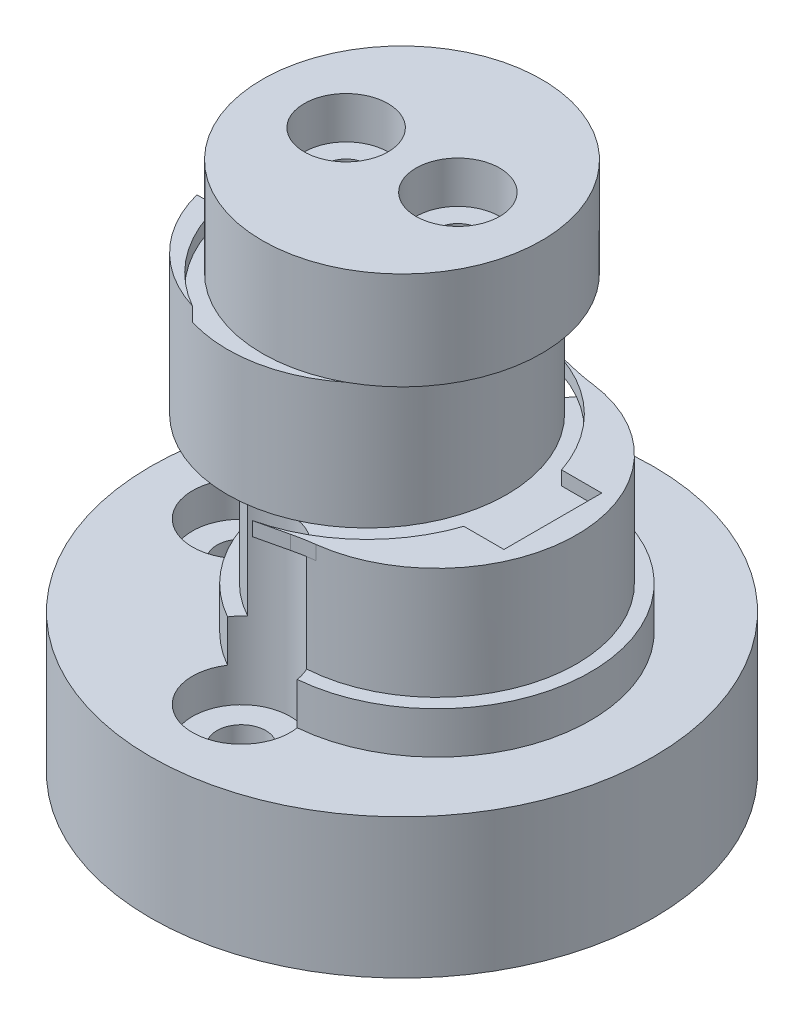
from build123d import *

# Parameters (mm, degrees)
SKETCH2_R           = 18
BOSS_EXTRUDE1_DEPTH = 10
SKETCH3_R           = 10
BOSS_EXTRUDE2_DEPTH = 10
SKETCH4_R           = 10
BOSS_EXTRUDE3_DEPTH = 10
SKETCH5_R           = 10
BOSS_EXTRUDE4_DEPTH = 8
SKETCH7_R           = 11
SKETCH7_R_2         = 10
BOSS_EXTRUDE5_DEPTH = 3
SKETCH8_R           = 11.000000000518183
SKETCH8_R_2         = 10.000000000518181
BOSS_EXTRUDE6_DEPTH = 1
SKETCH9_R           = 11
SKETCH9_R_2         = 2
BOSS_EXTRUDE7_DEPTH = 1
SKETCH11_R          = 1.4999999999999996
CUT_EXTRUDE4_DEPTH  = 35
SKETCH12_R          = 14.499999999998145
CUT_EXTRUDE5_DEPTH  = 5.5
SKETCH14_R          = 1.75
SKETCH14_R_2        = 1.7499999999999993
SKETCH14_R_3        = 1.7499999999999996
CUT_EXTRUDE6_DEPTH  = 4.5
CUT_EXTRUDE7_REACH  = 39.842
SKETCH15_R          = 3.5
SKETCH15_R_2        = 3.4999999999999996
CUT_EXTRUDE8_START  = -2.5
SKETCH15_2_R        = 3.5
SKETCH15_2_R_2      = 3.4999999999999996
CUT_EXTRUDE8_DEPTH  = 2.5
BOSS_EXTRUDE8_DEPTH = 1
CUT_EXTRUDE11_DEPTH = 4
SKETCH19_R          = 3
CUT_EXTRUDE12_DEPTH = 3
FILLET1_R           = 15
BOSS_EXTRUDE9_DEPTH = 1
CUT_EXTRUDE14_START = -1
SKETCH21_R          = 10.000000000518181
CUT_EXTRUDE14_DEPTH = 1
CUT_EXTRUDE18_DEPTH = 1


with BuildPart() as part:
    # Sketch2 → Boss-Extrude1 (new body)
    with BuildSketch(Plane.XZ):
        with Locations(Location((0, 0, 0), (0, 0, 270))):
            Circle(SKETCH2_R)
    extrude(amount=-BOSS_EXTRUDE1_DEPTH)

    # Sketch3 → Boss-Extrude2 (add)
    with BuildSketch(Plane(origin=(0, 10, 0), x_dir=(1, 0, 0), z_dir=(0, 1, 0))):
        with Locations(Location((2.5, 0, 0), (0, 0, 270))):
            Circle(SKETCH3_R)
    extrude(amount=BOSS_EXTRUDE2_DEPTH)

    # Sketch4 → Boss-Extrude3 (add)
    with BuildSketch(Plane(origin=(0, 20, 0), x_dir=(1, 0, 0), z_dir=(0, 1, 0))):
        with Locations(Location((-2.5000000000000004, 0, 0), (0, 0, 75.522487814))):
            Circle(SKETCH4_R)
    extrude(amount=BOSS_EXTRUDE3_DEPTH)

    # Sketch5 → Boss-Extrude4 (add)
    with BuildSketch(Plane(origin=(0, 30, 0), x_dir=(1, 0, 0), z_dir=(0, 1, 0))):
        with Locations(Location((0, 0, 0), (0, 0, 97.180755781))):
            Circle(SKETCH5_R)
    extrude(amount=BOSS_EXTRUDE4_DEPTH)

    # Sketch7 → Boss-Extrude5 (add)
    with BuildSketch(Plane(origin=(0, 10, 0), x_dir=(1, 0, 0), z_dir=(0, 1, 0))):
        with Locations(Location((2.5, 0, 0), (0, 0, 90))):
            Circle(SKETCH7_R)
        with Locations(Location((2.5, 0, 0), (0, 0, 104.477512186))):
            Circle(SKETCH7_R_2, mode=Mode.SUBTRACT)
    extrude(amount=BOSS_EXTRUDE5_DEPTH)

    # Sketch8 → Boss-Extrude6 (add)
    with BuildSketch(Plane(origin=(0, 20, 0), x_dir=(1, 0, 0), z_dir=(0, 1, 0))):
        with Locations(Location((-2.5000000000000004, 0, 0), (0, 0, 65.280148812))):
            Circle(SKETCH8_R)
        with Locations(Location((-2.5000000000000004, 0, 0), (0, 0, 82.819244219))):
            Circle(SKETCH8_R_2, mode=Mode.SUBTRACT)
    extrude(amount=BOSS_EXTRUDE6_DEPTH)

    # Sketch9 → Boss-Extrude7 (add)
    with BuildSketch(Plane(origin=(0, 30, 0), x_dir=(1, 0, 0), z_dir=(0, 1, 0))):
        with Locations(Location((0, 0, 0), (0, 0, 119.699728045))):
            Circle(SKETCH9_R)
        Circle(SKETCH9_R_2, mode=Mode.SUBTRACT)
    extrude(amount=BOSS_EXTRUDE7_DEPTH)

    # Sketch11 → Cut-Extrude4 (cut)
    with BuildSketch(Plane(origin=(0, 38, 0), x_dir=(1, 0, 0), z_dir=(0, 1, 0))):
        with Locations(Location((4, 0, 0), (0, 0, 270))):
            Circle(SKETCH11_R)
        with Locations(Location((-4, 0, 0), (0, 0, 90))):
            Circle(SKETCH11_R)
    extrude(amount=-CUT_EXTRUDE4_DEPTH, mode=Mode.SUBTRACT)

    # Sketch12 → Cut-Extrude5 (cut)
    with BuildSketch(Plane(origin=(0, 0, 0), x_dir=(-1, 0, 0), z_dir=(0, -1, 0))):
        with Locations(Location((0, 0, 0), (0, 0, 90))):
            Circle(SKETCH12_R)
    extrude(amount=-CUT_EXTRUDE5_DEPTH, mode=Mode.SUBTRACT)

    # Sketch14 → Cut-Extrude6 (cut)
    with BuildSketch(Plane(origin=(0, 10, 0), x_dir=(1, 0, 0), z_dir=(0, 1, 0))):
        with Locations(Location((-11.5, 2.65611e-12, 0), (0, 0, 270))):
            Circle(SKETCH14_R)
        with Locations(Location((0, -11.5, 0), (0, 0, 270))):
            Circle(SKETCH14_R_2)
        with Locations(Location((-4.23e-15, 11.5, 0), (0, 0, 270))):
            Circle(SKETCH14_R_3)
    extrude(amount=-CUT_EXTRUDE6_DEPTH, mode=Mode.SUBTRACT)

    # Cut-Extrude7: up to this face of the body (flat: up to its plane)
    cut_extrude7_end = Plane(part.part.faces().sort_by_distance((8.77903562, 20, 0))[0])
    # Sketch15 → Cut-Extrude7 (cut, up to the picked face)
    with BuildSketch(Plane(origin=(0, 10, 0), x_dir=(1, 0, 0), z_dir=(0, 1, 0)), mode=Mode.PRIVATE) as cut_extrude7_sk1:
        with Locations((-11.5, 2.65611e-12)):
            Circle(SKETCH15_R)
    cut_extrude7_tool1 = split(extrude(cut_extrude7_sk1.sketch, amount=CUT_EXTRUDE7_REACH, mode=Mode.PRIVATE), bisect_by=cut_extrude7_end, keep=Keep.BOTH, mode=Mode.PRIVATE)
    # Sketch15 → Cut-Extrude7 (cut, up to the picked face)
    with BuildSketch(Plane(origin=(0, 10, 0), x_dir=(1, 0, 0), z_dir=(0, 1, 0)), mode=Mode.PRIVATE) as cut_extrude7_sk2:
        with Locations((0, -11.5)):
            Circle(SKETCH15_R_2)
    cut_extrude7_tool2 = split(extrude(cut_extrude7_sk2.sketch, amount=CUT_EXTRUDE7_REACH, mode=Mode.PRIVATE), bisect_by=cut_extrude7_end, keep=Keep.BOTH, mode=Mode.PRIVATE)
    # Sketch15 → Cut-Extrude7 (cut, up to the picked face)
    with BuildSketch(Plane(origin=(0, 10, 0), x_dir=(1, 0, 0), z_dir=(0, 1, 0)), mode=Mode.PRIVATE) as cut_extrude7_sk3:
        with Locations((-4.23e-15, 11.5)):
            Circle(SKETCH15_R_2)
    cut_extrude7_tool3 = split(extrude(cut_extrude7_sk3.sketch, amount=CUT_EXTRUDE7_REACH, mode=Mode.PRIVATE), bisect_by=cut_extrude7_end, keep=Keep.BOTH, mode=Mode.PRIVATE)
    add(cut_extrude7_tool1.solids().sort_by(Axis((-11.5, 10, 0), (0, 1, 0)))[0], mode=Mode.SUBTRACT)
    add(cut_extrude7_tool2.solids().sort_by(Axis((0, 10, 11.5), (0, 1, 0)))[0], mode=Mode.SUBTRACT)
    add(cut_extrude7_tool3.solids().sort_by(Axis((0, 10, -11.5), (0, 1, 0)))[0], mode=Mode.SUBTRACT)

    # Sketch15<2> → Cut-Extrude8 (cut)
    with BuildSketch(Plane(origin=(0, 10, 0), x_dir=(1, 0, 0), z_dir=(0, 1, 0)).offset(CUT_EXTRUDE8_START)):
        with Locations(Location((-11.5, 2.65611e-12, 0), (0, 0, 27.088260677))):
            Circle(SKETCH15_2_R)
        with Locations(Location((0, -11.5, 0), (0, 0, 129.707264673))):
            Circle(SKETCH15_2_R_2)
        with Locations(Location((-4.23e-15, 11.5, 0), (0, 0, 351.09514002))):
            Circle(SKETCH15_2_R_2)
    extrude(amount=CUT_EXTRUDE8_DEPTH, mode=Mode.SUBTRACT)

    # Sketch16 → Boss-Extrude8 (add)
    with BuildSketch(Plane(origin=(0, 20, 0), x_dir=(1, 0, 0), z_dir=(0, 1, 0))):
        with BuildLine():
            Line((3.152093764490977, -9.97871603575891), (-0.00711323202179414, -10.713800239571357))
            ThreePointArc((-0.00711323202179414, -10.713800239571357), (1.497852610504287, -10.24778876226887), (2.920809977624914, -9.571563048838062))
            ThreePointArc((2.920809977624914, -9.571563048838062), (8.500000000518181, 2.44e-15), (2.920809977624908, 9.571563048838065))
            ThreePointArc((2.920809977624908, 9.571563048838065), (1.4978526105042804, 10.247788762268867), (-0.00711323202179414, 10.713800239571357))
            Line((-0.00711323202179414, 10.713800239571357), (3.152093764490974, 9.978716035758909))
            ThreePointArc((3.152093764490974, 9.978716035758909), (12.500000000000002, 2.22e-15), (3.152093764490977, -9.97871603575891))
        make_face()
    extrude(amount=BOSS_EXTRUDE8_DEPTH)

    # Sketch18 → Cut-Extrude11 (cut)
    with BuildSketch(Plane.XZ.offset(-5.5)):
        Polygon((-0.7091034656191317, 4.3e-16), (-2.3545517328095666, 2.8500000000000005), (-5.645448267190433, 2.85), (-7.290896534380867, 8.7e-16), (-5.6454482671904325, -2.8499999999999996), (-2.3545517328095644, -2.8499999999999996), align=None)
        Polygon((2.3545517328095644, -2.8499999999999996), (0.7091034656191317, 4.3e-16), (2.3545517328095666, 2.8500000000000005), (5.645448267190433, 2.85), (7.290896534380867, 8.7e-16), (5.6454482671904325, -2.8499999999999996), align=None)
    extrude(amount=-CUT_EXTRUDE11_DEPTH, mode=Mode.SUBTRACT)

    # Sketch19 → Cut-Extrude12 (cut)
    with BuildSketch(Plane(origin=(0, 38, 0), x_dir=(1, 0, 0), z_dir=(0, 1, 0))):
        with Locations(Location((4, 0, 0), (0, 0, 270))):
            Circle(SKETCH19_R)
        with Locations(Location((-4, 0, 0), (0, 0, 90))):
            Circle(SKETCH19_R)
    extrude(amount=-CUT_EXTRUDE12_DEPTH, mode=Mode.SUBTRACT)

    # Fillet1
    fillet1_edges = [part.edges().sort_by_distance(p)[0] for p in [
        (3.1520937644909774, 20.5, 9.97871603575891),
        (3.152093764490974, 20.5, -9.978716035758909),
    ]]
    fillet(fillet1_edges, radius=FILLET1_R)

    # Sketch20 → Boss-Extrude9 (add)
    with BuildSketch(Plane(origin=(0, 30, 0), x_dir=(1, 0, 0), z_dir=(0, 1, 0))):
        with BuildLine():
            ThreePointArc((-5.449999999999782, 9.554972527433101), (-5.980461913283042, 9.37477385701576), (-6.4999999999999964, 9.165151389911681))
            ThreePointArc((-6.4999999999999964, 9.165151389911681), (-12.5, 1.22e-15), (-6.5, -9.16515138991168))
            ThreePointArc((-6.5, -9.16515138991168), (-5.980461913282982, -9.374773857015782), (-5.449999999999655, -9.55497252743314))
            ThreePointArc((-5.449999999999692, -9.55497252743321), (-11, -6.216e-14), (-5.4499999999998, 9.554972527433147))
        make_face()
    extrude(amount=BOSS_EXTRUDE9_DEPTH)

    # Sketch21 → Cut-Extrude14 (cut)
    # profile 1 of 4: a face of its own
    with BuildSketch(Plane(origin=(0, 21, 0), x_dir=(1, 0, 0), z_dir=(0, 1, 0)).offset(CUT_EXTRUDE14_START)):
        with BuildLine():
            ThreePointArc((-0.00711323213923043, -10.713800239066654), (4.899268108135082, -8.139461374313111), (7.928326807307091, -3.500000000000044))
            Line((7.9283268073070765, -3.4999999999999996), (7.8000000000000025, -3.4999999999999996))
            Line((7.8000000000000025, -3.4999999999999996), (7.8000000000000025, 3.5000000000000004))
            Line((7.8000000000000025, 3.5000000000000004), (7.928326807307082, 3.5000000000000004))
            ThreePointArc((7.9283268073070925, 3.5000000000000395), (4.899268108135083, 8.13946137431311), (-0.00711323213922821, 10.713800239066654))
            ThreePointArc((-0.00711323202179459, 10.713800239571356), (-13.500000000518186, -1.33e-15), (-0.00711323202179193, -10.713800239571356))
        make_face()
        with Locations(Location((-2.5000000000000004, 0, 0), (0, 0, 107.157537372))):
            Circle(SKETCH21_R, mode=Mode.SUBTRACT)
    # profile 2 of 4: a face of its own
    with BuildSketch(Plane(origin=(0, 21, 0), x_dir=(1, 0, 0), z_dir=(0, 1, 0)).offset(CUT_EXTRUDE14_START)):
        with Locations(Location((-2.5000000000000004, 0, 0), (0, 0, 107.157537372))):
            Circle(SKETCH21_R)
    # profile 3 of 4: a face of its own
    with BuildSketch(Plane(origin=(0, 21, 0), x_dir=(1, 0, 0), z_dir=(0, 1, 0)).offset(CUT_EXTRUDE14_START)):
        with BuildLine():
            Line((7.9283268073070765, -3.4999999999999996), (10.8, -3.4999999999999996))
            Line((10.8, -3.4999999999999996), (10.8, 3.5000000000000004))
            Line((10.8, 3.5000000000000004), (7.928326807307082, 3.5000000000000004))
            ThreePointArc((7.9283268073070925, 3.5000000000000395), (8.35614100130378, 1.7731899390113273), (8.5, 0))
            ThreePointArc((8.5, -2.69e-15), (8.356141001303778, -1.773189939011331), (7.928326807307091, -3.500000000000044))
        make_face()
    # profile 4 of 4: a face of its own
    with BuildSketch(Plane(origin=(0, 21, 0), x_dir=(1, 0, 0), z_dir=(0, 1, 0)).offset(CUT_EXTRUDE14_START)):
        with BuildLine():
            Line((7.8000000000000025, -3.4999999999999996), (7.9283268073070765, -3.4999999999999996))
            ThreePointArc((7.928326807307091, -3.500000000000044), (8.356141001303778, -1.773189939011331), (8.5, -2.69e-15))
            ThreePointArc((8.5, 0), (8.35614100130378, 1.7731899390113273), (7.9283268073070925, 3.5000000000000395))
            Line((7.928326807307082, 3.5000000000000004), (7.8000000000000025, 3.5000000000000004))
            Line((7.8000000000000025, 3.5000000000000004), (7.8000000000000025, -3.4999999999999996))
        make_face()
    extrude(amount=CUT_EXTRUDE14_DEPTH, mode=Mode.SUBTRACT)


with BuildPart() as cut_extrude14_piece_1:
    # of the separate pieces the step leaves, piece 1, a body of its own (cut_extrude14_pieces)
    add(part.part.solids().sort_by_distance((2.226542235, 20, -10.194073342))[0])


with BuildPart() as cut_extrude14_piece_2:
    # of the separate pieces the step leaves, piece 2, a body of its own (cut_extrude14_pieces)
    add(part.part.solids().sort_by_distance((0, 21, -9.682458366))[0])

    # Sketch23 → Cut-Extrude18 (cut)
    with BuildSketch(Plane(origin=(0, 31, 0), x_dir=(1, 0, 0), z_dir=(0, 1, 0))):
        with BuildLine():
            Line((-12.748595347570808, 2.5000000000000004), (-12.748595347570808, -2.4999999999999996))
            Line((-12.748595347570808, -2.4999999999999996), (-12.182458365518658, -2.4999999999999996))
            ThreePointArc((-12.182458365518606, -2.499999999999765), (-12.5, 8.9e-16), (-12.182458365518604, 2.4999999999997686))
            Line((-12.182458365518656, 2.5000000000000004), (-12.748595347570808, 2.5000000000000004))
        make_face()
        with BuildLine():
            ThreePointArc((-12.182458365518604, 2.4999999999997686), (-12.5, 8.9e-16), (-12.182458365518606, -2.499999999999765))
            Line((-12.182458365518658, -2.4999999999999996), (-10.712142642814314, -2.4999999999999996))
            ThreePointArc((-10.712142642814296, -2.499999999999912), (-11, 1.35e-15), (-10.712142642814294, 2.4999999999999147))
            Line((-10.712142642814314, 2.5000000000000004), (-12.182458365518656, 2.5000000000000004))
        make_face()
        with BuildLine():
            ThreePointArc((-10.712142642814294, 2.4999999999999147), (-11, 1.35e-15), (-10.712142642814296, -2.499999999999912))
            Line((-10.712142642814314, -2.4999999999999996), (-9.682458365518459, -2.4999999999999996))
            ThreePointArc((-9.682458365518498, -2.5000000000001723), (-10, 1.22e-15), (-9.682458365518498, 2.500000000000175))
            Line((-9.682458365518459, 2.5000000000000004), (-10.712142642814314, 2.5000000000000004))
        make_face()
        with BuildLine():
            Line((-9.682458365518459, -2.4999999999999996), (-10.712142642814314, -2.4999999999999996))
            ThreePointArc((-10.712142642814296, -2.499999999999912), (-8.817418728991951, -6.576710952871652), (-5.4499999999999975, -9.554972527433033))
            ThreePointArc((-5.4499999999999975, -9.554972527433033), (5.524943438624508, -9.511834733635778), (11, -2.69e-15))
            ThreePointArc((11, 0), (5.5249434386245095, 9.511834733635776), (-5.449999999999995, 9.554972527433035))
            ThreePointArc((-5.449999999999995, 9.554972527433035), (-8.81741872899195, 6.576710952871655), (-10.712142642814294, 2.4999999999999147))
            Line((-10.712142642814314, 2.5000000000000004), (-9.682458365518459, 2.5000000000000004))
            ThreePointArc((-9.682458365518498, 2.500000000000175), (1.2600429248273706, 9.920296962671657), (10, 0))
            ThreePointArc((10, -2.45e-15), (1.2600429248273637, -9.920296962671657), (-9.682458365518498, -2.5000000000001723))
        make_face()
        with BuildLine():
            ThreePointArc((-9.682458365518498, 2.500000000000175), (-10, 1.22e-15), (-9.682458365518498, -2.5000000000001723))
            Line((-9.682458365518459, -2.4999999999999996), (-9.251404652429192, -2.4999999999999996))
            Line((-9.251404652429192, -2.4999999999999996), (-9.251404652429192, 2.5000000000000004))
            Line((-9.251404652429192, 2.5000000000000004), (-9.682458365518459, 2.5000000000000004))
        make_face()
        with BuildLine():
            Line((-9.251404652429192, -2.4999999999999996), (-9.682458365518459, -2.4999999999999996))
            ThreePointArc((-9.682458365518498, -2.5000000000001723), (1.2600429248273637, -9.920296962671657), (10, -2.45e-15))
            ThreePointArc((10, 0), (1.2600429248273706, 9.920296962671657), (-9.682458365518498, 2.500000000000175))
            Line((-9.682458365518459, 2.5000000000000004), (-9.251404652429192, 2.5000000000000004))
            Line((-9.251404652429192, 2.5000000000000004), (-9.251404652429192, -2.4999999999999996))
        make_face()
    extrude(amount=-CUT_EXTRUDE18_DEPTH, mode=Mode.SUBTRACT)


with BuildPart() as cut_extrude18_piece_1:
    # of the separate pieces the step leaves, piece 1, a body of its own (cut_extrude18_pieces)
    add(cut_extrude14_piece_2.part.solids().sort_by_distance((0, 21, -9.682458366))[0])


with BuildPart() as cut_extrude18_piece_2:
    # of the separate pieces the step leaves, piece 2, a body of its own (cut_extrude18_pieces)
    add(cut_extrude14_piece_2.part.solids().sort_by_distance((-4, 35, -1.5))[0])


solid = Compound([cut_extrude14_piece_1.part, cut_extrude18_piece_1.part, cut_extrude18_piece_2.part])
